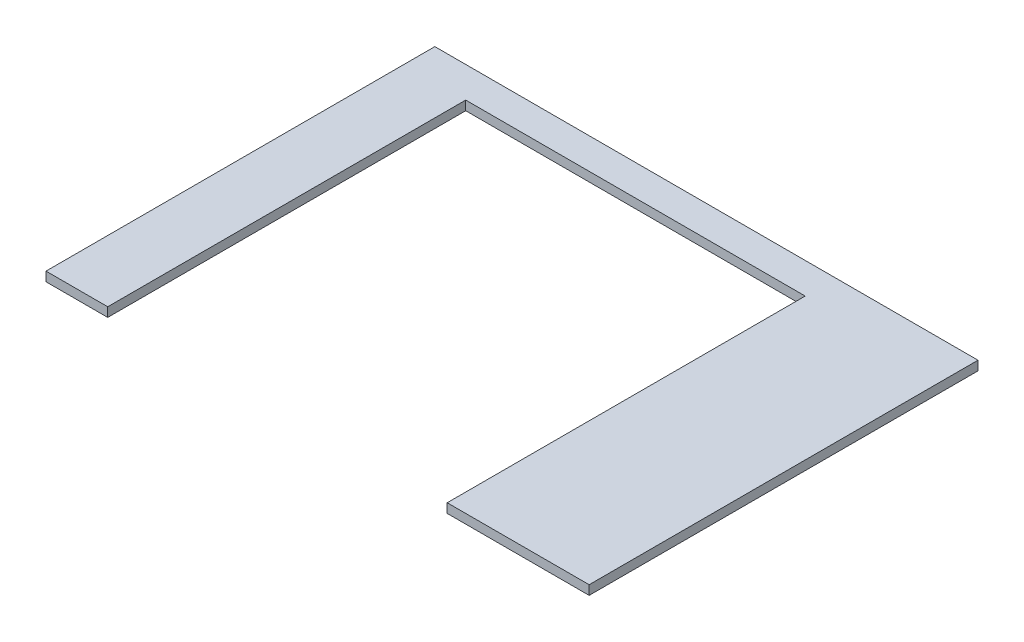
from build123d import *

# Parameters (mm, degrees)
EXTRUDE_1_DEPTH = 15


with BuildPart() as part:
    # Эскиз1 → Бобышка-Вытянуть1 (new body)
    with BuildSketch(Plane(origin=(0, 0, 0), x_dir=(1, 0, 0), z_dir=(0, 1, 0))):
        Polygon((100, 0), (100, 580), (650, 580), (650, 0), (880, 0), (880, 630), (0, 630), (0, 0), align=None)
    extrude(amount=EXTRUDE_1_DEPTH)


solid = part.part
